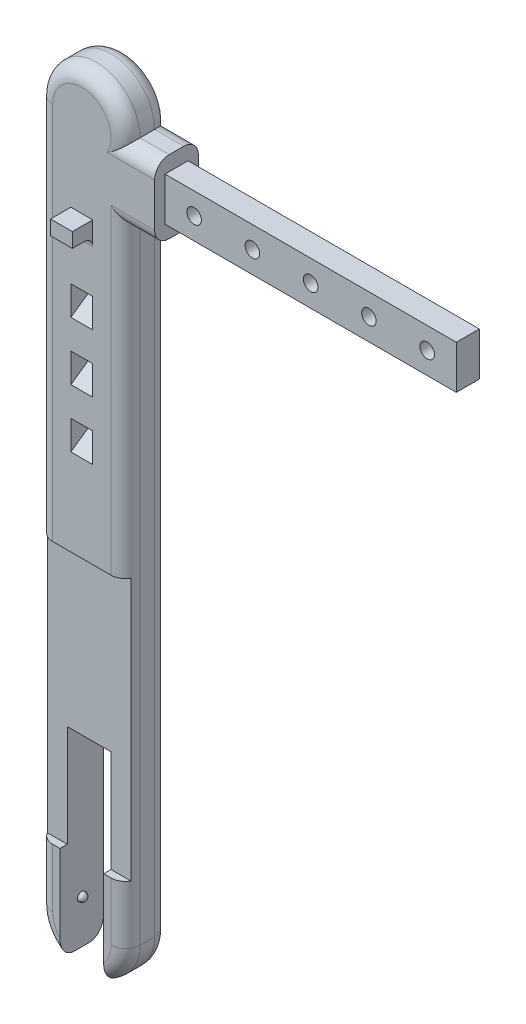
from build123d import *

# Parameters (mm, degrees)
BOSS_EXTRUDE1_DEPTH = 7.5
FILLET1_R           = 5
SKETCH2_W           = 7.9
SKETCH2_H           = 14.9
BOSS_EXTRUDE2_DEPTH = 100
SKETCH3_R           = 2.5
CUT_EXTRUDE1_DEPTH  = 100
SKETCH4_W           = 15
SKETCH4_H           = 70
CUT_EXTRUDE2_DEPTH  = 100
CUT_EXTRUDE3_DEPTH  = 3.75
BOSS_EXTRUDE3_DEPTH = 3.75
SKETCH10_W          = 2.5
SKETCH10_H          = 90
CUT_EXTRUDE4_DEPTH  = 199.475521198


with BuildPart() as part:
    # Sketch1 → Boss-Extrude1 (new, symmetric)
    with BuildSketch(Plane.XY):
        with BuildLine():
            Line((15, 99.936708861), (15, -115.063291139))
            ThreePointArc((15, -115.063291139), (0, -130.063291139), (-15, -115.063291139))
            Line((-15, -115.063291139), (-15, 124.936708861))
            ThreePointArc((-15, 124.936708861), (0, 139.936708861), (15, 124.936708861))
            Line((15, 124.936708861), (25, 124.936708861))
            Line((25, 124.936708861), (25, 99.936708861))
            Line((25, 99.936708861), (15, 99.936708861))
        make_face()
    extrude(amount=BOSS_EXTRUDE1_DEPTH, both=True)

    # Fillet1
    fillet1_edges = [part.edges().sort_by_distance(p)[0] for p in [
        (0, 139.936708861, -7.5),
        (-15, 4.936708861, -7.5),
        (0, -130.063291139, -7.5),
        (0, 139.936708861, 7.5),
        (-15, 4.936708861, 7.5),
        (0, -130.063291139, 7.5),
        (20, 99.936708861, -7.5),
        (20, 124.936708861, -7.5),
        (20, 124.936708861, 7.5),
        (20, 99.936708861, 7.5),
        (15, -7.563291139, -7.5),
        (15, -7.563291139, 7.5),
    ]]
    fillet(fillet1_edges, radius=FILLET1_R)

    # Sketch2 → Boss-Extrude2 (add)
    with BuildSketch(Plane(origin=(25, 0, 0), x_dir=(0, 0, -1), z_dir=(1, 0, 0))):
        with Locations((0, 112.436708861)):
            Rectangle(SKETCH2_W, SKETCH2_H)
    extrude(amount=BOSS_EXTRUDE2_DEPTH)

    # Sketch3 → Cut-Extrude1 (cut)
    with BuildSketch(Plane.XY.offset(3.95)):
        with Locations((35, 112.436708861)):
            Circle(SKETCH3_R)
        with Locations((55, 112.436708861)):
            Circle(SKETCH3_R)
        with Locations((75, 112.436708861)):
            Circle(SKETCH3_R)
        with Locations((95, 112.436708861)):
            Circle(SKETCH3_R)
        with Locations((115, 112.436708861)):
            Circle(SKETCH3_R)
    extrude(amount=-CUT_EXTRUDE1_DEPTH, mode=Mode.SUBTRACT)

    # Sketch4 → Cut-Extrude2 (cut)
    with BuildSketch(Plane.XY.offset(7.5)):
        with Locations((0, -95.063291139)):
            Rectangle(SKETCH4_W, SKETCH4_H)
    extrude(amount=-CUT_EXTRUDE2_DEPTH, mode=Mode.SUBTRACT)

    # Sketch7 → Cut-Extrude3 (cut, symmetric)
    with BuildSketch(Plane(origin=(0, 0, 0), x_dir=(0, 0, -1), z_dir=(1, 0, 0))):
        Polygon((0, 69.936708861), (-7.5, 64.685152324), (-7.5, 74.685152324), (0, 79.936708861), align=None)
        Polygon((0, 49.936708861), (0, 59.936708861), (-7.5, 54.685152324), (-7.5, 44.685152324), align=None)
        Polygon((0, 29.936708861), (0, 39.936708861), (-7.5, 34.685152324), (-7.5, 24.685152324), align=None)
    extrude(amount=CUT_EXTRUDE3_DEPTH, both=True, mode=Mode.SUBTRACT)

    # Sketch8 → Revolve1 (revolve)
    with BuildSketch(Plane.XY):
        with BuildLine():
            Line((-7.5, -113.063291139), (-6, -113.063291139))
            ThreePointArc((-6, -113.063291139), (-6.439339828, -112.002630967), (-7.5, -111.563291139))
            Line((-7.5, -111.563291139), (-7.5, -113.063291139))
        make_face()
        with BuildLine():
            Line((7.5, -113.063291139), (6, -113.063291139))
            ThreePointArc((6, -113.063291139), (6.439339828, -112.002630967), (7.5, -111.563291139))
            Line((7.5, -111.563291139), (7.5, -113.063291139))
        make_face()
    revolve(axis=Axis((-28.138828416, -113.063291139, 0), (1, 0, 0)))

    # Sketch9 → Boss-Extrude3 (add, symmetric)
    with BuildSketch(Plane(origin=(0, 0, 0), x_dir=(0, 0, -1), z_dir=(1, 0, 0))):
        with BuildLine():
            Line((-7.5, 89.436708861), (-7.5, 97.436708861))
            Line((-7.5, 97.436708861), (-14.5, 97.436708861))
            Line((-14.5, 97.436708861), (-14.5, 92.436708861))
            Line((-14.5, 92.436708861), (-10.5, 92.436708861))
            ThreePointArc((-10.5, 92.436708861), (-8.378679656, 91.558029204), (-7.5, 89.436708861))
        make_face()
    extrude(amount=BOSS_EXTRUDE3_DEPTH, both=True)

    # Sketch10 → Cut-Extrude4 (cut, through all)
    with BuildSketch(Plane.ZY.offset(15)):
        with Locations((6.25, -50.063291139)):
            Rectangle(SKETCH10_W, SKETCH10_H)
    extrude(amount=-CUT_EXTRUDE4_DEPTH, mode=Mode.SUBTRACT)


solid = part.part
